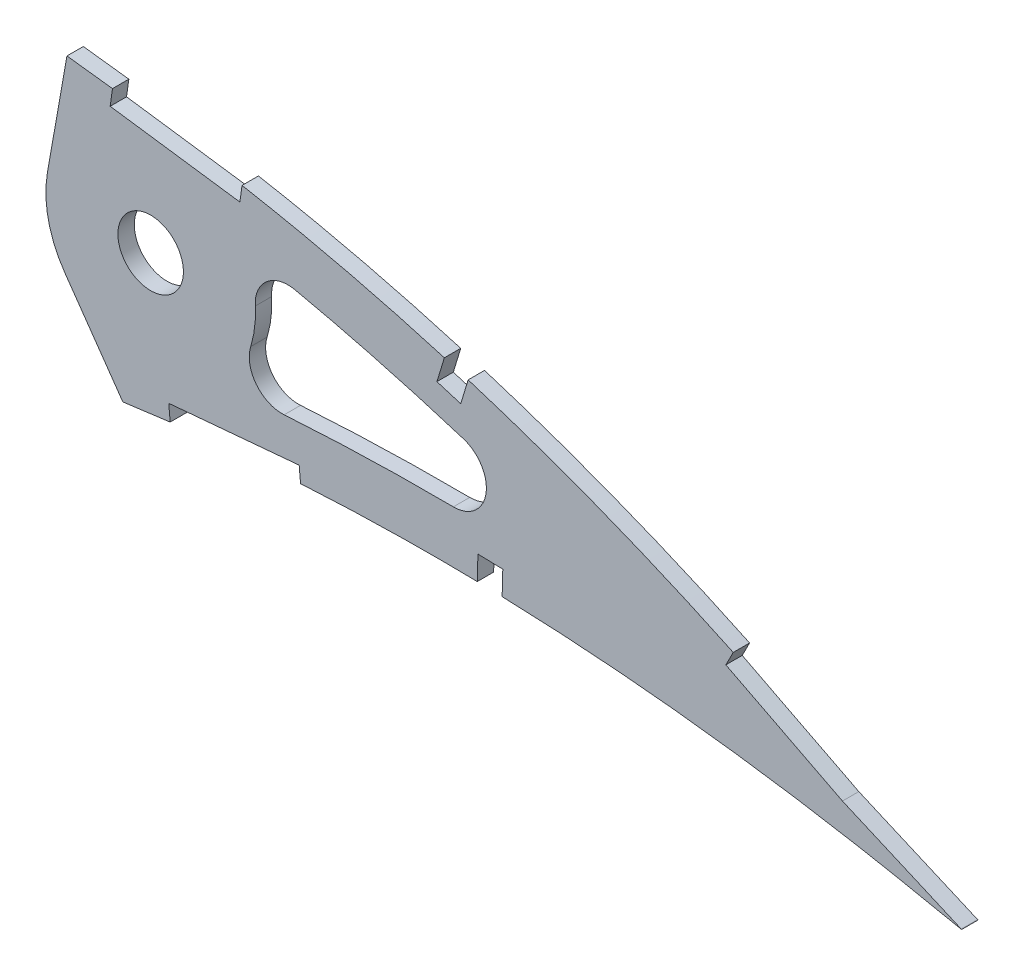
from build123d import *

# Parameters (mm, degrees)
BOSS_EXTRUDE1_DEPTH = 3.175
SKETCH4_R           = 6.35
CUT_EXTRUDE3_DEPTH  = 7.62
CUT_EXTRUDE4_DEPTH  = 7.62
FILLET1_R           = 6.35


with BuildPart() as part:
    # Sketch1 → Boss-Extrude1 (new body)
    with BuildSketch(Plane.XY):
        with BuildLine():
            Line((519.580178516, -0.811051185), (524.404942797, -1.768650656))
            Line((524.404942797, -1.768650656), (520.229019484, 0.811051185))
            add(Edge.make_bspline(
                [(520.229019484, 0.811051185), (520.189166605, 0.835670541), (520.029909792, 0.934052399), (519.671075297, 1.154156729), (519.073541109, 1.52075127), (518.237045599, 2.031290225), (517.162238007, 2.684417324), (515.848577801, 3.475559373), (514.296885216, 4.402146321), (512.507535633, 5.459795421), (510.480712337, 6.64355473), (508.21718701, 7.948628257), (505.717156954, 9.367627965), (502.981590452, 10.894755239), (500.011426026, 12.522747531), (496.807225449, 14.244251548), (493.37013628, 16.050511122), (489.701477824, 17.933756977), (485.801919013, 19.88358962), (481.673298347, 21.891894303), (477.316991217, 23.948657398), (472.734484625, 26.042905917), (467.928411224, 28.166102482), (462.900099753, 30.30504754), (457.652415647, 32.45047346), (452.187593096, 34.590170691), (446.508867721, 36.714394111), (440.618430338, 38.809382682), (434.52068427, 40.865980983), (428.218587641, 42.870829), (421.71664718, 44.813038248), (415.018640596, 46.680016502), (408.130151416, 48.4621889), (401.05554842, 50.146576673), (393.800827801, 51.721905645), (386.37175624, 53.178690862), (378.7745642, 54.502388693), (371.03030434, 55.691966852), (363.263579962, 56.681494561), (355.512835044, 57.651994424), (347.773632806, 58.563690257), (339.939841334, 59.436765181), (332.018997168, 60.266303487), (324.018957152, 61.049711288), (315.947820171, 61.783607472), (307.813973652, 62.465839869), (299.625288266, 63.092542591), (291.390398495, 63.662750235), (283.117445562, 64.171449818), (274.815241205, 64.618259557), (266.492213302, 65.000063177), (258.157023363, 65.314229919), (249.818522106, 65.558863312), (241.485365181, 65.731619671), (233.166575282, 65.831412809), (224.870805251, 65.855515939), (216.607073574, 65.803497941), (208.384033719, 65.673572684), (200.210713382, 65.463961556), (192.095777843, 65.174273359), (184.048002143, 64.804633746), (176.076197788, 64.351947189), (168.189012741, 63.819098613), (160.39523005, 63.203849575), (152.703412853, 62.5060365), (145.121622257, 61.728568125), (137.65829938, 60.86932984), (130.321442651, 59.930766435), (123.119077117, 58.914718085), (116.059284027, 57.820631377), (109.149625996, 56.651666482), (102.397560522, 55.409019412), (95.81023125, 54.096333304), (89.394810054, 52.713950514), (83.158087983, 51.266017865), (77.106546628, 49.75505799), (71.246691254, 48.18383703), (65.58446207, 46.556125144), (60.125584795, 44.875615234), (54.876423204, 43.144153764), (49.840944503, 41.368305654), (45.025334256, 39.549331576), (40.433281375, 37.692835265), (36.070167381, 35.80135162), (31.939251719, 33.880646801), (28.045209615, 31.932907511), (24.39081638, 29.963590665), (20.979740738, 27.975715944), (17.815266227, 25.972975661), (14.898722839, 23.96044987), (12.234131686, 21.939401784), (9.822408113, 19.914938493), (7.665078309, 17.890142748), (5.765226023, 15.866409302), (4.122782784, 13.847302025), (2.739901149, 11.834419923), (1.61682102, 9.829667672), (0.75608259, 7.834501578), (0.156832386, 5.85004365), (-0.171193188, 3.879222922), (-0.252840734, 1.920459398), (-0.084154315, 0.639196632), (0, 0)],
                knots=[0, 0, 0, 0, 0.00025409, 0.001015373, 0.002283359, 0.004056577, 0.006330982, 0.009105275, 0.012374489, 0.016134023, 0.02037966, 0.025105976, 0.030306237, 0.035972206, 0.042099522, 0.048678064, 0.055701664, 0.063160184, 0.071045824, 0.079349826, 0.08806291, 0.097175757, 0.106678112, 0.116561573, 0.126814276, 0.1374283, 0.148393618, 0.15969976, 0.171338126, 0.183297699, 0.195569604, 0.208143556, 0.221011593, 0.234161831, 0.24758745, 0.261276822, 0.27522271, 0.289414144, 0.3037712, 0.317689227, 0.331784111, 0.346039677, 0.36044387, 0.374982721, 0.389640455, 0.404403317, 0.419256601, 0.434186749, 0.449177265, 0.464214782, 0.479284009, 0.49436974, 0.509457833, 0.524532346, 0.53957932, 0.554582984, 0.569529546, 0.584403417, 0.599190992, 0.613876838, 0.628447475, 0.642888675, 0.657186054, 0.671325546, 0.685294014, 0.699078147, 0.712665095, 0.726042645, 0.739197713, 0.752117586, 0.764792042, 0.777208152, 0.789355685, 0.80122396, 0.812803686, 0.824082909, 0.835054602, 0.845709571, 0.856037853, 0.866033834, 0.875688843, 0.884997719, 0.893953426, 0.902552897, 0.910789386, 0.918660734, 0.926166253, 0.933302626, 0.94007122, 0.94647478, 0.952517526, 0.958204819, 0.963546652, 0.9685566, 0.973249913, 0.977651041, 0.981787043, 0.985694226, 0.989415109, 0.993001157, 0.996508416, 1, 1, 1, 1], degree=3))
            add(Edge.make_bspline(
                [(0, 0), (0.133592971, -0.630647919), (0.401392883, -1.8948421), (1.12897029, -3.714757932), (2.091156676, -5.464224213), (3.308146123, -7.138593951), (4.771846833, -8.737409521), (6.479026026, -10.262333902), (8.42800953, -11.712547121), (10.616246406, -13.087389262), (13.040557967, -14.388319695), (15.69821927, -15.614529628), (18.58680706, -16.765635887), (21.703174164, -17.840099654), (25.043510698, -18.839557444), (28.604640883, -19.761573512), (32.382515332, -20.607436647), (36.373500457, -21.374987622), (40.573247311, -22.065006311), (44.977392966, -22.677106427), (49.581416855, -23.211670923), (54.380802091, -23.667578066), (59.370801609, -24.045808466), (64.546441805, -24.346612989), (69.902698778, -24.570945614), (75.434441794, -24.717953346), (81.136253147, -24.789928223), (87.002979994, -24.787950681), (93.028883282, -24.711491768), (99.208815464, -24.564775433), (105.536846201, -24.346872236), (112.007262561, -24.060419153), (118.614228145, -23.708298892), (125.351817225, -23.291705179), (132.214100493, -22.812484346), (139.195119589, -22.274479418), (146.288532921, -21.679032497), (153.488154076, -21.029614162), (160.787609185, -20.329475604), (168.180591644, -19.580832593), (175.660575836, -18.787206853), (183.220899465, -17.951170059), (190.855131019, -17.077182461), (198.556296664, -16.166825422), (206.317884213, -15.225296547), (214.132591981, -14.254394805), (221.993885293, -13.257859815), (229.894693671, -12.240383742), (237.827620604, -11.201850487), (245.785993956, -10.149659277), (253.762138918, -9.082943465), (261.749112783, -8.007189221), (269.739522148, -6.925740253), (277.725584215, -5.838929488), (285.70027901, -4.751260828), (293.656208576, -3.665720235), (301.585579958, -2.582406874), (309.481219182, -1.506705212), (317.335175518, -0.438483792), (325.140206955, 0.620091626), (332.888833934, 1.665861231), (340.573746099, 2.697505345), (348.187015915, 3.714371056), (355.720983847, 4.716840325), (363.055280122, 5.674485749), (370.170740115, 6.638302095), (377.091341637, 7.428417974), (383.925772848, 8.102810237), (390.681133097, 8.655718896), (397.349310673, 9.095098533), (403.922665289, 9.424088714), (410.393362863, 9.647282626), (416.753229966, 9.771301523), (422.994322965, 9.799292754), (429.108122993, 9.740182902), (435.086678505, 9.598736647), (440.921645401, 9.381302955), (446.604883368, 9.095217537), (452.128319892, 8.748279397), (457.483662622, 8.34560601), (462.663449177, 7.896598156), (467.65968785, 7.407828642), (472.464706853, 6.884881883), (477.071494939, 6.338715544), (481.472678479, 5.77292572), (485.661637464, 5.196810252), (489.631628754, 4.616207627), (493.376364947, 4.038530197), (496.889962423, 3.469289139), (500.16674573, 2.91603967), (503.201581909, 2.38395084), (505.989204715, 1.878219093), (508.525746868, 1.40522509), (510.806198597, 0.967318665), (512.827510034, 0.571716412), (514.585922757, 0.220164109), (516.078859088, -0.082385429), (517.303711765, -0.334738039), (518.258620558, -0.532751237), (518.941699265, -0.676741413), (519.352209069, -0.762422848), (519.534603778, -0.801329602), (519.580178516, -0.811051185)],
                knots=[0, 0, 0, 0, 0.003638255, 0.007293231, 0.011028136, 0.014901081, 0.018963272, 0.023258475, 0.027820626, 0.032679082, 0.03785316, 0.043361875, 0.049214679, 0.055422346, 0.061988786, 0.068918036, 0.076211157, 0.083868392, 0.091887411, 0.100265912, 0.108999867, 0.118084529, 0.127514843, 0.13728527, 0.147387917, 0.157816481, 0.168563473, 0.179619128, 0.190977373, 0.202626974, 0.214560478, 0.226767249, 0.239236417, 0.251959004, 0.264923894, 0.278119703, 0.291536035, 0.30516028, 0.318980685, 0.332985499, 0.34716279, 0.361498603, 0.375980747, 0.390597192, 0.405332593, 0.420174823, 0.435109533, 0.450124276, 0.465203068, 0.480333154, 0.495500583, 0.510689775, 0.525887334, 0.541078314, 0.556247233, 0.571381784, 0.586466041, 0.601484516, 0.616424329, 0.631269422, 0.646006524, 0.660620684, 0.675098188, 0.689422858, 0.703581825, 0.716907564, 0.730009274, 0.742952128, 0.755725558, 0.768319952, 0.780724337, 0.792926529, 0.804916041, 0.816679084, 0.828203524, 0.8394749, 0.850481359, 0.861207697, 0.871639326, 0.881763414, 0.891563605, 0.901027364, 0.910138977, 0.918883976, 0.927249278, 0.935221104, 0.942784739, 0.949928188, 0.956638464, 0.962904203, 0.968712287, 0.974054485, 0.978918432, 0.983297219, 0.987180246, 0.990560674, 0.993433357, 0.995790625, 0.997629587, 0.998945816, 0.999736592, 1, 1, 1, 1], degree=3))
        make_face()
    extrude(amount=BOSS_EXTRUDE1_DEPTH)

    # Sketch4 → Cut-Extrude3 (cut)
    with BuildSketch(Plane(origin=(0, 0, 0), x_dir=(-1, 0, 0), z_dir=(0, 0, -1))):
        with BuildLine():
            ThreePointArc((-347.130907312, 36.761105856), (-347.303865989, 28.834521931), (-350.497031314, 21.577501699))
            Line((-350.497031314, 21.577501699), (-361.749554482, 5.507233166))
            add(Edge.make_bspline(
                [(-361.749554482, 5.507233166), (-359.750002253, 5.242796176), (-355.23730571, 4.652482144), (-348.187015915, 3.714371056), (-340.573746099, 2.697505345), (-332.888833934, 1.665861231), (-325.140206955, 0.620091626), (-317.335175518, -0.438483792), (-309.481219182, -1.506705212), (-301.585579958, -2.582406874), (-293.656208576, -3.665720235), (-285.70027901, -4.751260828), (-277.725584215, -5.838929488), (-269.739522148, -6.925740253), (-261.749112783, -8.007189221), (-253.762138918, -9.082943465), (-245.785993956, -10.149659277), (-237.827620604, -11.201850487), (-229.894693671, -12.240383742), (-221.993885293, -13.257859815), (-214.132591981, -14.254394805), (-206.317884213, -15.225296547), (-198.556296664, -16.166825422), (-190.855131019, -17.077182461), (-183.220899465, -17.951170059), (-175.660575836, -18.787206853), (-168.180591644, -19.580832593), (-160.787609185, -20.329475604), (-153.488154076, -21.029614162), (-146.288532921, -21.679032497), (-139.195119589, -22.274479418), (-132.214100493, -22.812484346), (-125.351817225, -23.291705179), (-118.614228145, -23.708298892), (-112.007262561, -24.060419153), (-105.536846201, -24.346872236), (-99.208815464, -24.564775433), (-93.028883282, -24.711491768), (-87.002979994, -24.787950681), (-81.136253147, -24.789928223), (-75.434441794, -24.717953346), (-69.902698778, -24.570945614), (-64.546441805, -24.346612989), (-59.370801609, -24.045808466), (-54.380802091, -23.667578066), (-49.581416855, -23.211670923), (-44.977392966, -22.677106427), (-40.573247311, -22.065006311), (-36.373500457, -21.374987622), (-32.382515332, -20.607436647), (-28.604640883, -19.761573512), (-25.043510698, -18.839557444), (-21.703174164, -17.840099654), (-18.58680706, -16.765635887), (-15.69821927, -15.614529628), (-13.040557967, -14.388319695), (-10.616246406, -13.087389262), (-8.42800953, -11.712547121), (-6.479026026, -10.262333902), (-4.771846833, -8.737409521), (-3.308146123, -7.138593951), (-2.091156676, -5.464224213), (-1.12897029, -3.714757932), (-0.401392883, -1.8948421), (-0.133592971, -0.630647919), (0, 0)],
                knots=[0.03869149, 0.03869149, 0.03869149, 0.03869149, 0.050092366, 0.064417037, 0.07889454, 0.0935087, 0.108245802, 0.123090895, 0.138030708, 0.153049184, 0.16813344, 0.183267991, 0.19843691, 0.21362789, 0.228825449, 0.244014641, 0.25918207, 0.274312157, 0.289390949, 0.304405692, 0.319340401, 0.334182631, 0.348918032, 0.363534477, 0.378016622, 0.392352434, 0.406529725, 0.420534539, 0.434354945, 0.447979189, 0.461395522, 0.47459133, 0.48755622, 0.500278807, 0.512747975, 0.524954746, 0.53688825, 0.548537851, 0.559896096, 0.570951751, 0.581698744, 0.592127307, 0.602229954, 0.612000381, 0.621430695, 0.630515357, 0.639249312, 0.647627813, 0.655646832, 0.663304067, 0.670597188, 0.677526438, 0.684092878, 0.690300545, 0.696153349, 0.701662064, 0.706836142, 0.711694598, 0.716256749, 0.720551952, 0.724614143, 0.728487088, 0.732221993, 0.735876969, 0.739515224, 0.739515224, 0.739515224, 0.739515224], degree=3))
            add(Edge.make_bspline(
                [(0, 0), (0.084154315, 0.639196632), (0.252840734, 1.920459398), (0.171193188, 3.879222922), (-0.156832386, 5.85004365), (-0.75608259, 7.834501578), (-1.61682102, 9.829667672), (-2.739901149, 11.834419923), (-4.122782784, 13.847302025), (-5.765226023, 15.866409302), (-7.665078309, 17.890142748), (-9.822408113, 19.914938493), (-12.234131686, 21.939401784), (-14.898722839, 23.96044987), (-17.815266227, 25.972975661), (-20.979740738, 27.975715944), (-24.39081638, 29.963590665), (-28.045209615, 31.932907511), (-31.939251719, 33.880646801), (-36.070167381, 35.80135162), (-40.433281375, 37.692835265), (-45.025334256, 39.549331576), (-49.840944503, 41.368305654), (-54.876423204, 43.144153764), (-60.125584795, 44.875615234), (-65.58446207, 46.556125144), (-71.246691254, 48.18383703), (-77.106546628, 49.75505799), (-83.158087983, 51.266017865), (-89.394810054, 52.713950514), (-95.81023125, 54.096333304), (-102.397560522, 55.409019412), (-109.149625996, 56.651666482), (-116.059284027, 57.820631377), (-123.119077117, 58.914718085), (-130.321442651, 59.930766435), (-137.65829938, 60.86932984), (-145.121622257, 61.728568125), (-152.703412853, 62.5060365), (-160.39523005, 63.203849575), (-168.189012741, 63.819098613), (-176.076197788, 64.351947189), (-184.048002143, 64.804633746), (-192.095777843, 65.174273359), (-200.210713382, 65.463961556), (-208.384033719, 65.673572684), (-216.607073574, 65.803497941), (-224.870805251, 65.855515939), (-233.166575282, 65.831412809), (-241.485365181, 65.731619671), (-249.818522106, 65.558863312), (-258.157023363, 65.314229919), (-266.492213302, 65.000063177), (-274.815241205, 64.618259557), (-283.117445562, 64.171449818), (-291.390398495, 63.662750235), (-299.625288266, 63.092542591), (-307.813973652, 62.465839869), (-315.947820171, 61.783607472), (-324.018957152, 61.049711288), (-332.018997168, 60.266303487), (-339.939841334, 59.436765181), (-346.227461312, 58.736010846), (-349.87402552, 58.313335631), (-350.909730833, 58.191878985)],
                knots=[0.963359057, 0.963359057, 0.963359057, 0.963359057, 0.966850641, 0.970357899, 0.973943948, 0.97766483, 0.981572014, 0.985708016, 0.990109144, 0.994802457, 0.999812404, 1.005154238, 1.010841531, 1.016884277, 1.023287836, 1.030056431, 1.037192803, 1.044698322, 1.052569671, 1.060806159, 1.069405631, 1.078361338, 1.087670214, 1.097325222, 1.107321203, 1.117649485, 1.128304454, 1.139276147, 1.150555371, 1.162135097, 1.174003372, 1.186150905, 1.198567015, 1.21124147, 1.224161344, 1.237316412, 1.250693962, 1.264280909, 1.278065043, 1.292033511, 1.306173003, 1.320470382, 1.334911582, 1.349482219, 1.364168065, 1.37895564, 1.393829511, 1.408776073, 1.423779737, 1.43882671, 1.453901224, 1.468989317, 1.484075048, 1.499144274, 1.514181792, 1.529172307, 1.544102456, 1.55895574, 1.573718602, 1.588376336, 1.602915187, 1.61731938, 1.631574945, 1.637231259, 1.637231259, 1.637231259, 1.637231259], degree=3))
            Line((-350.909730833, 58.191878985), (-347.130907312, 36.761105856))
        make_face()
        with Locations((-367.142200854, 33.232574886)):
            Circle(SKETCH4_R)
        with BuildLine():
            ThreePointArc((-387.462200854, 33.232574886), (-386.814278928, 38.322932855), (-384.911832325, 43.088669314))
            add(Edge.make_bspline(
                [(-466.381536904, 17.739023349), (-464.077384324, 18.757444743), (-461.765249862, 19.752184237), (-457.118450141, 21.69708064), (-454.786398451, 22.646347671), (-450.10385626, 24.497815956), (-447.75240197, 25.400700405), (-443.035237053, 27.157945334), (-440.669001058, 28.012063218), (-428.788452876, 32.165169282), (-419.157290014, 35.099148044), (-404.551556817, 38.892321547), (-399.659263176, 40.054506405), (-392.285300647, 41.643217334), (-389.821414131, 42.147253508), (-386.540289083, 42.782388067), (-385.726343584, 42.936953373), (-384.911832325, 43.088669314)],
                knots=[0, 0, 0, 0, 0.015625, 0.015625, 0.03125, 0.03125, 0.046875, 0.046875, 0.0625, 0.0625, 0.125, 0.125, 0.15625, 0.15625, 0.171875, 0.171875, 0.177026295, 0.177026295, 0.177026295, 0.177026295], degree=3))
            add(Edge.make_bspline(
                [(-380.561771086, 17.974215381), (-381.333926082, 18.048413309), (-382.106576309, 18.12056427), (-385.407153236, 18.419587346), (-387.935449623, 18.625484759), (-395.52207913, 19.176670751), (-400.588304878, 19.455243016), (-408.190000105, 19.738575875), (-410.723661334, 19.810841317), (-415.79361755, 19.911332927), (-418.330137741, 19.939186396), (-425.933912422, 19.956601518), (-431.001864577, 19.881497473), (-441.132423715, 19.557892286), (-446.190669671, 19.310202102), (-453.772484524, 18.813875302), (-456.298225615, 18.627115644), (-461.342325377, 18.213449628), (-463.862465791, 17.986463508), (-466.381536904, 17.739023349)],
                knots=[0.823343682, 0.823343682, 0.823343682, 0.823343682, 0.828125, 0.828125, 0.84375, 0.84375, 0.875, 0.875, 0.890625, 0.890625, 0.90625, 0.90625, 0.9375, 0.9375, 0.96875, 0.96875, 0.984375, 0.984375, 1, 1, 1, 1], degree=3))
            ThreePointArc((-380.561771086, 17.974215381), (-385.656898625, 24.859500992), (-387.462200854, 33.232574886))
        make_face()
    extrude(amount=-CUT_EXTRUDE3_DEPTH, mode=Mode.SUBTRACT)

    # Sketch5 → Cut-Extrude4 (cut)
    with BuildSketch(Plane.XY.offset(3.175)):
        Polygon((430.47640415, 9.564371746), (435.299189247, 9.436333747), (435.427227246, 14.259118844), (430.604442149, 14.387156843), align=None)
        Polygon((370.652391531, 9.724495467), (370.934324926, 6.563166846), (396.224953897, 8.818634007), (395.943020502, 11.979962629), align=None)
        Polygon((359.730550578, 57.0740322), (360.354958806, 61.547717189), (384.883001855, 55.31872337), (384.883001855, 53.56341454), (384.444174647, 50.419358131), (359.291723371, 53.929975791), align=None)
        Polygon((424.062053567, 43.982510938), (424.549022553, 45.583034765), (428.891030458, 43.280386749), (428.677404958, 42.578262561), (427.273156581, 37.962911171), (422.657805191, 39.367159548), align=None)
        Polygon((480.124414871, 22.640333852), (478.679160871, 19.81341576), (501.294505608, 8.251383756), (524.603235395, -1.841205854), (525.864809096, 1.072385369), (502.648511375, 11.124952253), align=None)
    extrude(amount=-CUT_EXTRUDE4_DEPTH, mode=Mode.SUBTRACT)


with BuildPart() as body_2:
    # of the pieces the cut leaves, the one that is kept (cut_extrude4_keep)
    add(part.part.solids().sort_by_distance((519.580178516, -0.811051185, 0))[0])

    # Fillet1
    fillet1_edges = [body_2.edges().sort_by_distance(p)[0] for p in [
        (466.381536904, 17.739023349, 1.5875),
        (380.561771086, 17.974215381, 1.5875),
        (384.911832325, 43.088669314, 1.5875),
    ]]
    fillet(fillet1_edges, radius=FILLET1_R)


solid = body_2.part
